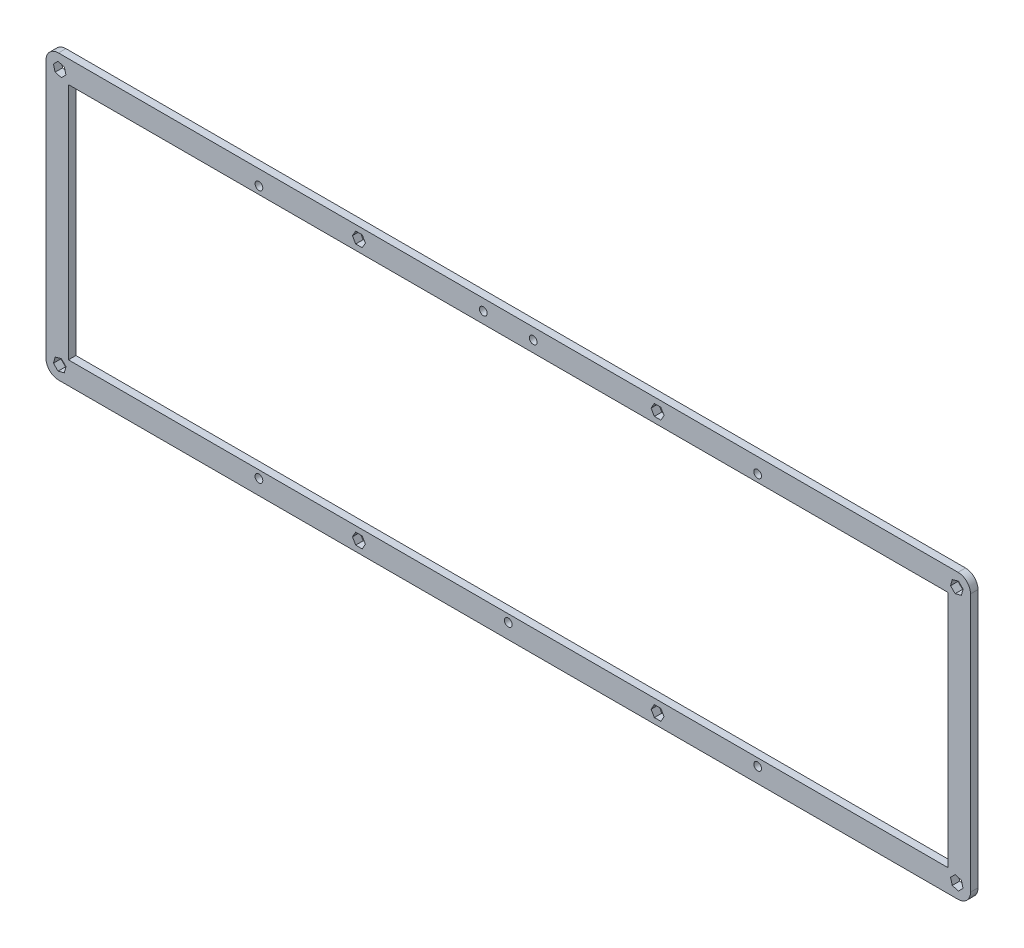
from build123d import *

# Parameters (mm, degrees)
MODEL_R             = 1.55
MODEL_W             = 352.775
MODEL_H             = 95.6
BOSS_EXTRUDE1_DEPTH = 3


with BuildPart() as part:
    # Model → Boss-Extrude1 (new body)
    with BuildSketch(Plane.XY):
        with BuildLine():
            Line((0, 108.6), (0, 5))
            ThreePointArc((0, 5), (1.464466094, 1.464466094), (5, 0))
            Line((5, 0), (365.775, 0))
            ThreePointArc((365.775, 0), (369.310533906, 1.464466094), (370.775, 5))
            Line((370.775, 5), (370.775, 108.6))
            ThreePointArc((370.775, 108.6), (369.310533906, 112.135533906), (365.775, 113.6))
            Line((365.775, 113.6), (5, 113.6))
            ThreePointArc((5, 113.6), (1.464466094, 112.135533906), (0, 108.6))
        make_face()
        with Locations((195.3875, 109.1)):
            Circle(MODEL_R, mode=Mode.SUBTRACT)
        with Locations((175.3875, 109.1)):
            Circle(MODEL_R, mode=Mode.SUBTRACT)
        with Locations((85.3875, 107.6)):
            Circle(MODEL_R, mode=Mode.SUBTRACT)
        with Locations((285.3875, 107.6)):
            Circle(MODEL_R, mode=Mode.SUBTRACT)
        with Locations((85.3875, 6)):
            Circle(MODEL_R, mode=Mode.SUBTRACT)
        with Locations((185.3875, 6)):
            Circle(MODEL_R, mode=Mode.SUBTRACT)
        with Locations((285.3875, 6)):
            Circle(MODEL_R, mode=Mode.SUBTRACT)
        with Locations((185.3875, 56.8)):
            Rectangle(MODEL_W, MODEL_H, mode=Mode.SUBTRACT)
        Polygon((365.947431604, 110.609548911), (367.784548911, 108.772431604), (367.112117307, 106.262882693), (364.602568396, 105.590451089), (362.765451089, 107.427568396), (363.437882693, 109.937117307), align=None, mode=Mode.SUBTRACT)
        Polygon((4.827568396, 110.609548911), (2.990451089, 108.772431604), (3.662882693, 106.262882693), (6.172431604, 105.590451089), (8.009548911, 107.427568396), (7.337117307, 109.937117307), align=None, mode=Mode.SUBTRACT)
        Polygon((365.947431604, 2.990451089), (367.784548911, 4.827568396), (367.112117307, 7.337117307), (364.602568396, 8.009548911), (362.765451089, 6.172431604), (363.437882693, 3.662882693), align=None, mode=Mode.SUBTRACT)
        Polygon((126.799038106, 2.25), (124.200961894, 2.25), (122.901923789, 4.5), (124.200961894, 6.75), (126.799038106, 6.75), (128.098076211, 4.5), align=None, mode=Mode.SUBTRACT)
        Polygon((4.827568396, 2.990451089), (2.990451089, 4.827568396), (3.662882693, 7.337117307), (6.172431604, 8.009548911), (8.009548911, 6.172431604), (7.337117307, 3.662882693), align=None, mode=Mode.SUBTRACT)
        Polygon((126.799038106, 111.35), (124.200961894, 111.35), (122.901923789, 109.1), (124.200961894, 106.85), (126.799038106, 106.85), (128.098076211, 109.1), align=None, mode=Mode.SUBTRACT)
        Polygon((243.975961894, 2.25), (246.574038106, 2.25), (247.873076211, 4.5), (246.574038106, 6.75), (243.975961894, 6.75), (242.676923789, 4.5), align=None, mode=Mode.SUBTRACT)
        Polygon((243.975961894, 111.35), (246.574038106, 111.35), (247.873076211, 109.1), (246.574038106, 106.85), (243.975961894, 106.85), (242.676923789, 109.1), align=None, mode=Mode.SUBTRACT)
    extrude(amount=BOSS_EXTRUDE1_DEPTH)


solid = part.part
